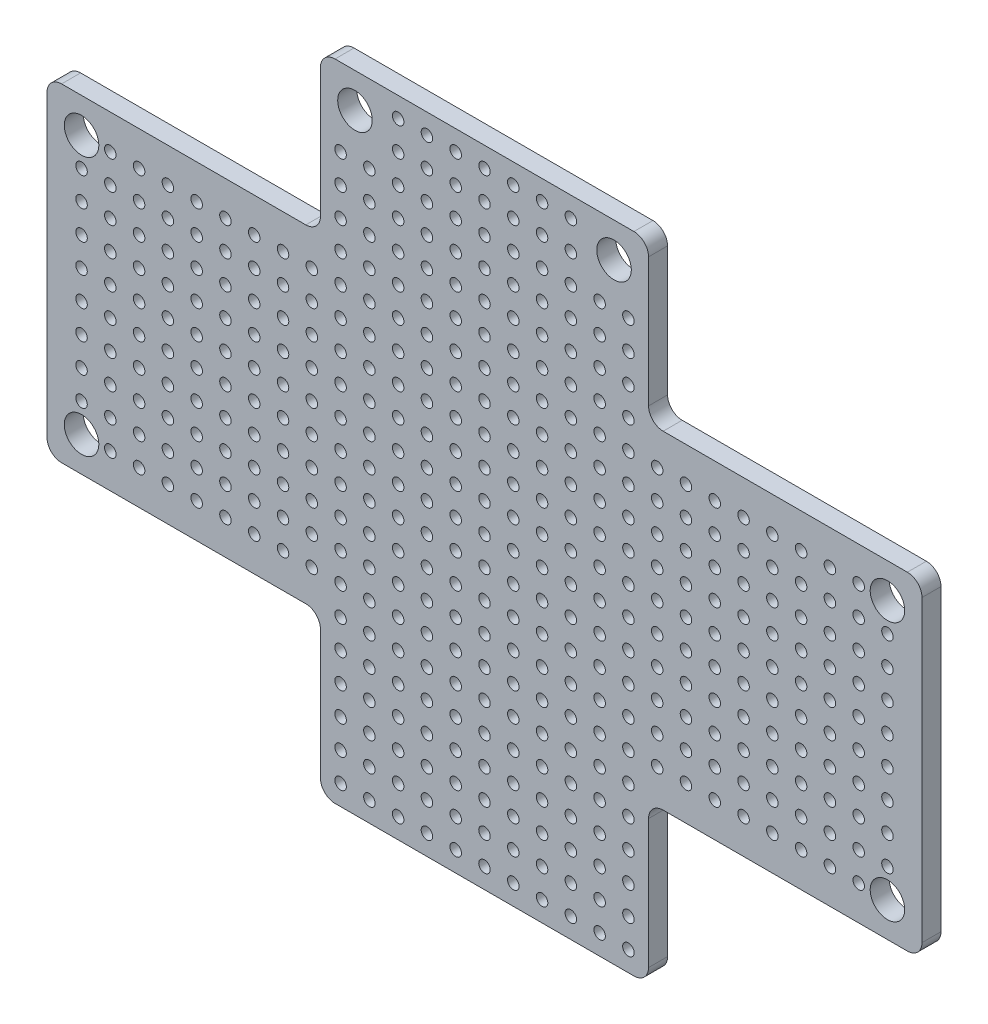
from build123d import *

# Parameters (mm, degrees)
SKETCH1_R           = 1.5
SKETCH1_R_2         = 0.5
BOSS_EXTRUDE1_DEPTH = 1.651
FILLET1_R           = 1.27


with BuildPart() as part:
    # Sketch1 → Boss-Extrude1 (new body)
    with BuildSketch(Plane.XY):
        Polygon((0, 0), (23.75, 0), (23.75, -13.75), (52.25, -13.75), (52.25, 0), (76, 0), (76, 28.5), (52.25, 28.5), (52.25, 42.25), (23.75, 42.25), (23.75, 28.5), (0, 28.5), align=None)
        with Locations((3, 25.5)):
            Circle(SKETCH1_R, mode=Mode.SUBTRACT)
        with Locations((73, 25.5)):
            Circle(SKETCH1_R, mode=Mode.SUBTRACT)
        with Locations((3, 3)):
            Circle(SKETCH1_R, mode=Mode.SUBTRACT)
        with Locations((73, 3)):
            Circle(SKETCH1_R, mode=Mode.SUBTRACT)
        with Locations((26.75, 39.25)):
            Circle(SKETCH1_R, mode=Mode.SUBTRACT)
        with Locations((5.5, 3)):
            Circle(SKETCH1_R_2, mode=Mode.SUBTRACT)
        with Locations((8, 3)):
            Circle(SKETCH1_R_2, mode=Mode.SUBTRACT)
        with Locations((10.5, 3)):
            Circle(SKETCH1_R_2, mode=Mode.SUBTRACT)
        with Locations((13, 3)):
            Circle(SKETCH1_R_2, mode=Mode.SUBTRACT)
        with Locations((15.5, 3)):
            Circle(SKETCH1_R_2, mode=Mode.SUBTRACT)
        with Locations((18, 3)):
            Circle(SKETCH1_R_2, mode=Mode.SUBTRACT)
        with Locations((20.5, 3)):
            Circle(SKETCH1_R_2, mode=Mode.SUBTRACT)
        with Locations((23, 3)):
            Circle(SKETCH1_R_2, mode=Mode.SUBTRACT)
        with Locations((25.5, 3)):
            Circle(SKETCH1_R_2, mode=Mode.SUBTRACT)
        with Locations((28, 3)):
            Circle(SKETCH1_R_2, mode=Mode.SUBTRACT)
        with Locations((30.5, 3)):
            Circle(SKETCH1_R_2, mode=Mode.SUBTRACT)
        with Locations((33, 3)):
            Circle(SKETCH1_R_2, mode=Mode.SUBTRACT)
        with Locations((35.5, 3)):
            Circle(SKETCH1_R_2, mode=Mode.SUBTRACT)
        with Locations((38, 3)):
            Circle(SKETCH1_R_2, mode=Mode.SUBTRACT)
        with Locations((40.5, 3)):
            Circle(SKETCH1_R_2, mode=Mode.SUBTRACT)
        with Locations((43, 3)):
            Circle(SKETCH1_R_2, mode=Mode.SUBTRACT)
        with Locations((45.5, 3)):
            Circle(SKETCH1_R_2, mode=Mode.SUBTRACT)
        with Locations((48, 3)):
            Circle(SKETCH1_R_2, mode=Mode.SUBTRACT)
        with Locations((50.5, 3)):
            Circle(SKETCH1_R_2, mode=Mode.SUBTRACT)
        with Locations((53, 3)):
            Circle(SKETCH1_R_2, mode=Mode.SUBTRACT)
        with Locations((55.5, 3)):
            Circle(SKETCH1_R_2, mode=Mode.SUBTRACT)
        with Locations((58, 3)):
            Circle(SKETCH1_R_2, mode=Mode.SUBTRACT)
        with Locations((60.5, 3)):
            Circle(SKETCH1_R_2, mode=Mode.SUBTRACT)
        with Locations((63, 3)):
            Circle(SKETCH1_R_2, mode=Mode.SUBTRACT)
        with Locations((65.5, 3)):
            Circle(SKETCH1_R_2, mode=Mode.SUBTRACT)
        with Locations((68, 3)):
            Circle(SKETCH1_R_2, mode=Mode.SUBTRACT)
        with Locations((70.5, 3)):
            Circle(SKETCH1_R_2, mode=Mode.SUBTRACT)
        with Locations((49.25, 39.25)):
            Circle(SKETCH1_R, mode=Mode.SUBTRACT)
        with Locations((5.5, 5.5)):
            Circle(SKETCH1_R_2, mode=Mode.SUBTRACT)
        with Locations((8, 5.5)):
            Circle(SKETCH1_R_2, mode=Mode.SUBTRACT)
        with Locations((10.5, 5.5)):
            Circle(SKETCH1_R_2, mode=Mode.SUBTRACT)
        with Locations((13, 5.5)):
            Circle(SKETCH1_R_2, mode=Mode.SUBTRACT)
        with Locations((15.5, 5.5)):
            Circle(SKETCH1_R_2, mode=Mode.SUBTRACT)
        with Locations((18, 5.5)):
            Circle(SKETCH1_R_2, mode=Mode.SUBTRACT)
        with Locations((20.5, 5.5)):
            Circle(SKETCH1_R_2, mode=Mode.SUBTRACT)
        with Locations((23, 5.5)):
            Circle(SKETCH1_R_2, mode=Mode.SUBTRACT)
        with Locations((25.5, 5.5)):
            Circle(SKETCH1_R_2, mode=Mode.SUBTRACT)
        with Locations((28, 5.5)):
            Circle(SKETCH1_R_2, mode=Mode.SUBTRACT)
        with Locations((30.5, 5.5)):
            Circle(SKETCH1_R_2, mode=Mode.SUBTRACT)
        with Locations((33, 5.5)):
            Circle(SKETCH1_R_2, mode=Mode.SUBTRACT)
        with Locations((35.5, 5.5)):
            Circle(SKETCH1_R_2, mode=Mode.SUBTRACT)
        with Locations((38, 5.5)):
            Circle(SKETCH1_R_2, mode=Mode.SUBTRACT)
        with Locations((40.5, 5.5)):
            Circle(SKETCH1_R_2, mode=Mode.SUBTRACT)
        with Locations((43, 5.5)):
            Circle(SKETCH1_R_2, mode=Mode.SUBTRACT)
        with Locations((45.5, 5.5)):
            Circle(SKETCH1_R_2, mode=Mode.SUBTRACT)
        with Locations((48, 5.5)):
            Circle(SKETCH1_R_2, mode=Mode.SUBTRACT)
        with Locations((50.5, 5.5)):
            Circle(SKETCH1_R_2, mode=Mode.SUBTRACT)
        with Locations((53, 5.5)):
            Circle(SKETCH1_R_2, mode=Mode.SUBTRACT)
        with Locations((55.5, 5.5)):
            Circle(SKETCH1_R_2, mode=Mode.SUBTRACT)
        with Locations((58, 5.5)):
            Circle(SKETCH1_R_2, mode=Mode.SUBTRACT)
        with Locations((60.5, 5.5)):
            Circle(SKETCH1_R_2, mode=Mode.SUBTRACT)
        with Locations((63, 5.5)):
            Circle(SKETCH1_R_2, mode=Mode.SUBTRACT)
        with Locations((65.5, 5.5)):
            Circle(SKETCH1_R_2, mode=Mode.SUBTRACT)
        with Locations((68, 5.5)):
            Circle(SKETCH1_R_2, mode=Mode.SUBTRACT)
        with Locations((70.5, 5.5)):
            Circle(SKETCH1_R_2, mode=Mode.SUBTRACT)
        with Locations((73, 5.5)):
            Circle(SKETCH1_R_2, mode=Mode.SUBTRACT)
        with Locations((5.5, 8)):
            Circle(SKETCH1_R_2, mode=Mode.SUBTRACT)
        with Locations((8, 8)):
            Circle(SKETCH1_R_2, mode=Mode.SUBTRACT)
        with Locations((10.5, 8)):
            Circle(SKETCH1_R_2, mode=Mode.SUBTRACT)
        with Locations((13, 8)):
            Circle(SKETCH1_R_2, mode=Mode.SUBTRACT)
        with Locations((15.5, 8)):
            Circle(SKETCH1_R_2, mode=Mode.SUBTRACT)
        with Locations((18, 8)):
            Circle(SKETCH1_R_2, mode=Mode.SUBTRACT)
        with Locations((20.5, 8)):
            Circle(SKETCH1_R_2, mode=Mode.SUBTRACT)
        with Locations((23, 8)):
            Circle(SKETCH1_R_2, mode=Mode.SUBTRACT)
        with Locations((25.5, 8)):
            Circle(SKETCH1_R_2, mode=Mode.SUBTRACT)
        with Locations((28, 8)):
            Circle(SKETCH1_R_2, mode=Mode.SUBTRACT)
        with Locations((30.5, 8)):
            Circle(SKETCH1_R_2, mode=Mode.SUBTRACT)
        with Locations((33, 8)):
            Circle(SKETCH1_R_2, mode=Mode.SUBTRACT)
        with Locations((35.5, 8)):
            Circle(SKETCH1_R_2, mode=Mode.SUBTRACT)
        with Locations((38, 8)):
            Circle(SKETCH1_R_2, mode=Mode.SUBTRACT)
        with Locations((40.5, 8)):
            Circle(SKETCH1_R_2, mode=Mode.SUBTRACT)
        with Locations((43, 8)):
            Circle(SKETCH1_R_2, mode=Mode.SUBTRACT)
        with Locations((45.5, 8)):
            Circle(SKETCH1_R_2, mode=Mode.SUBTRACT)
        with Locations((48, 8)):
            Circle(SKETCH1_R_2, mode=Mode.SUBTRACT)
        with Locations((50.5, 8)):
            Circle(SKETCH1_R_2, mode=Mode.SUBTRACT)
        with Locations((53, 8)):
            Circle(SKETCH1_R_2, mode=Mode.SUBTRACT)
        with Locations((55.5, 8)):
            Circle(SKETCH1_R_2, mode=Mode.SUBTRACT)
        with Locations((58, 8)):
            Circle(SKETCH1_R_2, mode=Mode.SUBTRACT)
        with Locations((60.5, 8)):
            Circle(SKETCH1_R_2, mode=Mode.SUBTRACT)
        with Locations((63, 8)):
            Circle(SKETCH1_R_2, mode=Mode.SUBTRACT)
        with Locations((65.5, 8)):
            Circle(SKETCH1_R_2, mode=Mode.SUBTRACT)
        with Locations((68, 8)):
            Circle(SKETCH1_R_2, mode=Mode.SUBTRACT)
        with Locations((70.5, 8)):
            Circle(SKETCH1_R_2, mode=Mode.SUBTRACT)
        with Locations((73, 8)):
            Circle(SKETCH1_R_2, mode=Mode.SUBTRACT)
        with Locations((5.5, 10.5)):
            Circle(SKETCH1_R_2, mode=Mode.SUBTRACT)
        with Locations((8, 10.5)):
            Circle(SKETCH1_R_2, mode=Mode.SUBTRACT)
        with Locations((10.5, 10.5)):
            Circle(SKETCH1_R_2, mode=Mode.SUBTRACT)
        with Locations((13, 10.5)):
            Circle(SKETCH1_R_2, mode=Mode.SUBTRACT)
        with Locations((15.5, 10.5)):
            Circle(SKETCH1_R_2, mode=Mode.SUBTRACT)
        with Locations((18, 10.5)):
            Circle(SKETCH1_R_2, mode=Mode.SUBTRACT)
        with Locations((20.5, 10.5)):
            Circle(SKETCH1_R_2, mode=Mode.SUBTRACT)
        with Locations((23, 10.5)):
            Circle(SKETCH1_R_2, mode=Mode.SUBTRACT)
        with Locations((25.5, 10.5)):
            Circle(SKETCH1_R_2, mode=Mode.SUBTRACT)
        with Locations((28, 10.5)):
            Circle(SKETCH1_R_2, mode=Mode.SUBTRACT)
        with Locations((30.5, 10.5)):
            Circle(SKETCH1_R_2, mode=Mode.SUBTRACT)
        with Locations((33, 10.5)):
            Circle(SKETCH1_R_2, mode=Mode.SUBTRACT)
        with Locations((35.5, 10.5)):
            Circle(SKETCH1_R_2, mode=Mode.SUBTRACT)
        with Locations((38, 10.5)):
            Circle(SKETCH1_R_2, mode=Mode.SUBTRACT)
        with Locations((40.5, 10.5)):
            Circle(SKETCH1_R_2, mode=Mode.SUBTRACT)
        with Locations((43, 10.5)):
            Circle(SKETCH1_R_2, mode=Mode.SUBTRACT)
        with Locations((45.5, 10.5)):
            Circle(SKETCH1_R_2, mode=Mode.SUBTRACT)
        with Locations((48, 10.5)):
            Circle(SKETCH1_R_2, mode=Mode.SUBTRACT)
        with Locations((50.5, 10.5)):
            Circle(SKETCH1_R_2, mode=Mode.SUBTRACT)
        with Locations((53, 10.5)):
            Circle(SKETCH1_R_2, mode=Mode.SUBTRACT)
        with Locations((55.5, 10.5)):
            Circle(SKETCH1_R_2, mode=Mode.SUBTRACT)
        with Locations((58, 10.5)):
            Circle(SKETCH1_R_2, mode=Mode.SUBTRACT)
        with Locations((60.5, 10.5)):
            Circle(SKETCH1_R_2, mode=Mode.SUBTRACT)
        with Locations((63, 10.5)):
            Circle(SKETCH1_R_2, mode=Mode.SUBTRACT)
        with Locations((65.5, 10.5)):
            Circle(SKETCH1_R_2, mode=Mode.SUBTRACT)
        with Locations((68, 10.5)):
            Circle(SKETCH1_R_2, mode=Mode.SUBTRACT)
        with Locations((70.5, 10.5)):
            Circle(SKETCH1_R_2, mode=Mode.SUBTRACT)
        with Locations((73, 10.5)):
            Circle(SKETCH1_R_2, mode=Mode.SUBTRACT)
        with Locations((5.5, 13)):
            Circle(SKETCH1_R_2, mode=Mode.SUBTRACT)
        with Locations((8, 13)):
            Circle(SKETCH1_R_2, mode=Mode.SUBTRACT)
        with Locations((10.5, 13)):
            Circle(SKETCH1_R_2, mode=Mode.SUBTRACT)
        with Locations((13, 13)):
            Circle(SKETCH1_R_2, mode=Mode.SUBTRACT)
        with Locations((15.5, 13)):
            Circle(SKETCH1_R_2, mode=Mode.SUBTRACT)
        with Locations((18, 13)):
            Circle(SKETCH1_R_2, mode=Mode.SUBTRACT)
        with Locations((20.5, 13)):
            Circle(SKETCH1_R_2, mode=Mode.SUBTRACT)
        with Locations((23, 13)):
            Circle(SKETCH1_R_2, mode=Mode.SUBTRACT)
        with Locations((25.5, 13)):
            Circle(SKETCH1_R_2, mode=Mode.SUBTRACT)
        with Locations((28, 13)):
            Circle(SKETCH1_R_2, mode=Mode.SUBTRACT)
        with Locations((30.5, 13)):
            Circle(SKETCH1_R_2, mode=Mode.SUBTRACT)
        with Locations((33, 13)):
            Circle(SKETCH1_R_2, mode=Mode.SUBTRACT)
        with Locations((35.5, 13)):
            Circle(SKETCH1_R_2, mode=Mode.SUBTRACT)
        with Locations((38, 13)):
            Circle(SKETCH1_R_2, mode=Mode.SUBTRACT)
        with Locations((40.5, 13)):
            Circle(SKETCH1_R_2, mode=Mode.SUBTRACT)
        with Locations((43, 13)):
            Circle(SKETCH1_R_2, mode=Mode.SUBTRACT)
        with Locations((45.5, 13)):
            Circle(SKETCH1_R_2, mode=Mode.SUBTRACT)
        with Locations((48, 13)):
            Circle(SKETCH1_R_2, mode=Mode.SUBTRACT)
        with Locations((50.5, 13)):
            Circle(SKETCH1_R_2, mode=Mode.SUBTRACT)
        with Locations((53, 13)):
            Circle(SKETCH1_R_2, mode=Mode.SUBTRACT)
        with Locations((55.5, 13)):
            Circle(SKETCH1_R_2, mode=Mode.SUBTRACT)
        with Locations((58, 13)):
            Circle(SKETCH1_R_2, mode=Mode.SUBTRACT)
        with Locations((60.5, 13)):
            Circle(SKETCH1_R_2, mode=Mode.SUBTRACT)
        with Locations((63, 13)):
            Circle(SKETCH1_R_2, mode=Mode.SUBTRACT)
        with Locations((65.5, 13)):
            Circle(SKETCH1_R_2, mode=Mode.SUBTRACT)
        with Locations((68, 13)):
            Circle(SKETCH1_R_2, mode=Mode.SUBTRACT)
        with Locations((70.5, 13)):
            Circle(SKETCH1_R_2, mode=Mode.SUBTRACT)
        with Locations((73, 13)):
            Circle(SKETCH1_R_2, mode=Mode.SUBTRACT)
        with Locations((5.5, 15.5)):
            Circle(SKETCH1_R_2, mode=Mode.SUBTRACT)
        with Locations((8, 15.5)):
            Circle(SKETCH1_R_2, mode=Mode.SUBTRACT)
        with Locations((10.5, 15.5)):
            Circle(SKETCH1_R_2, mode=Mode.SUBTRACT)
        with Locations((13, 15.5)):
            Circle(SKETCH1_R_2, mode=Mode.SUBTRACT)
        with Locations((15.5, 15.5)):
            Circle(SKETCH1_R_2, mode=Mode.SUBTRACT)
        with Locations((18, 15.5)):
            Circle(SKETCH1_R_2, mode=Mode.SUBTRACT)
        with Locations((20.5, 15.5)):
            Circle(SKETCH1_R_2, mode=Mode.SUBTRACT)
        with Locations((23, 15.5)):
            Circle(SKETCH1_R_2, mode=Mode.SUBTRACT)
        with Locations((25.5, 15.5)):
            Circle(SKETCH1_R_2, mode=Mode.SUBTRACT)
        with Locations((28, 15.5)):
            Circle(SKETCH1_R_2, mode=Mode.SUBTRACT)
        with Locations((30.5, 15.5)):
            Circle(SKETCH1_R_2, mode=Mode.SUBTRACT)
        with Locations((33, 15.5)):
            Circle(SKETCH1_R_2, mode=Mode.SUBTRACT)
        with Locations((35.5, 15.5)):
            Circle(SKETCH1_R_2, mode=Mode.SUBTRACT)
        with Locations((38, 15.5)):
            Circle(SKETCH1_R_2, mode=Mode.SUBTRACT)
        with Locations((40.5, 15.5)):
            Circle(SKETCH1_R_2, mode=Mode.SUBTRACT)
        with Locations((43, 15.5)):
            Circle(SKETCH1_R_2, mode=Mode.SUBTRACT)
        with Locations((45.5, 15.5)):
            Circle(SKETCH1_R_2, mode=Mode.SUBTRACT)
        with Locations((48, 15.5)):
            Circle(SKETCH1_R_2, mode=Mode.SUBTRACT)
        with Locations((50.5, 15.5)):
            Circle(SKETCH1_R_2, mode=Mode.SUBTRACT)
        with Locations((53, 15.5)):
            Circle(SKETCH1_R_2, mode=Mode.SUBTRACT)
        with Locations((55.5, 15.5)):
            Circle(SKETCH1_R_2, mode=Mode.SUBTRACT)
        with Locations((58, 15.5)):
            Circle(SKETCH1_R_2, mode=Mode.SUBTRACT)
        with Locations((60.5, 15.5)):
            Circle(SKETCH1_R_2, mode=Mode.SUBTRACT)
        with Locations((63, 15.5)):
            Circle(SKETCH1_R_2, mode=Mode.SUBTRACT)
        with Locations((65.5, 15.5)):
            Circle(SKETCH1_R_2, mode=Mode.SUBTRACT)
        with Locations((68, 15.5)):
            Circle(SKETCH1_R_2, mode=Mode.SUBTRACT)
        with Locations((70.5, 15.5)):
            Circle(SKETCH1_R_2, mode=Mode.SUBTRACT)
        with Locations((73, 15.5)):
            Circle(SKETCH1_R_2, mode=Mode.SUBTRACT)
        with Locations((5.5, 18)):
            Circle(SKETCH1_R_2, mode=Mode.SUBTRACT)
        with Locations((8, 18)):
            Circle(SKETCH1_R_2, mode=Mode.SUBTRACT)
        with Locations((10.5, 18)):
            Circle(SKETCH1_R_2, mode=Mode.SUBTRACT)
        with Locations((13, 18)):
            Circle(SKETCH1_R_2, mode=Mode.SUBTRACT)
        with Locations((15.5, 18)):
            Circle(SKETCH1_R_2, mode=Mode.SUBTRACT)
        with Locations((18, 18)):
            Circle(SKETCH1_R_2, mode=Mode.SUBTRACT)
        with Locations((20.5, 18)):
            Circle(SKETCH1_R_2, mode=Mode.SUBTRACT)
        with Locations((23, 18)):
            Circle(SKETCH1_R_2, mode=Mode.SUBTRACT)
        with Locations((25.5, 18)):
            Circle(SKETCH1_R_2, mode=Mode.SUBTRACT)
        with Locations((28, 18)):
            Circle(SKETCH1_R_2, mode=Mode.SUBTRACT)
        with Locations((30.5, 18)):
            Circle(SKETCH1_R_2, mode=Mode.SUBTRACT)
        with Locations((33, 18)):
            Circle(SKETCH1_R_2, mode=Mode.SUBTRACT)
        with Locations((35.5, 18)):
            Circle(SKETCH1_R_2, mode=Mode.SUBTRACT)
        with Locations((38, 18)):
            Circle(SKETCH1_R_2, mode=Mode.SUBTRACT)
        with Locations((40.5, 18)):
            Circle(SKETCH1_R_2, mode=Mode.SUBTRACT)
        with Locations((43, 18)):
            Circle(SKETCH1_R_2, mode=Mode.SUBTRACT)
        with Locations((45.5, 18)):
            Circle(SKETCH1_R_2, mode=Mode.SUBTRACT)
        with Locations((48, 18)):
            Circle(SKETCH1_R_2, mode=Mode.SUBTRACT)
        with Locations((50.5, 18)):
            Circle(SKETCH1_R_2, mode=Mode.SUBTRACT)
        with Locations((53, 18)):
            Circle(SKETCH1_R_2, mode=Mode.SUBTRACT)
        with Locations((55.5, 18)):
            Circle(SKETCH1_R_2, mode=Mode.SUBTRACT)
        with Locations((58, 18)):
            Circle(SKETCH1_R_2, mode=Mode.SUBTRACT)
        with Locations((60.5, 18)):
            Circle(SKETCH1_R_2, mode=Mode.SUBTRACT)
        with Locations((63, 18)):
            Circle(SKETCH1_R_2, mode=Mode.SUBTRACT)
        with Locations((65.5, 18)):
            Circle(SKETCH1_R_2, mode=Mode.SUBTRACT)
        with Locations((68, 18)):
            Circle(SKETCH1_R_2, mode=Mode.SUBTRACT)
        with Locations((70.5, 18)):
            Circle(SKETCH1_R_2, mode=Mode.SUBTRACT)
        with Locations((73, 18)):
            Circle(SKETCH1_R_2, mode=Mode.SUBTRACT)
        with Locations((5.5, 20.5)):
            Circle(SKETCH1_R_2, mode=Mode.SUBTRACT)
        with Locations((8, 20.5)):
            Circle(SKETCH1_R_2, mode=Mode.SUBTRACT)
        with Locations((10.5, 20.5)):
            Circle(SKETCH1_R_2, mode=Mode.SUBTRACT)
        with Locations((13, 20.5)):
            Circle(SKETCH1_R_2, mode=Mode.SUBTRACT)
        with Locations((15.5, 20.5)):
            Circle(SKETCH1_R_2, mode=Mode.SUBTRACT)
        with Locations((18, 20.5)):
            Circle(SKETCH1_R_2, mode=Mode.SUBTRACT)
        with Locations((20.5, 20.5)):
            Circle(SKETCH1_R_2, mode=Mode.SUBTRACT)
        with Locations((23, 20.5)):
            Circle(SKETCH1_R_2, mode=Mode.SUBTRACT)
        with Locations((25.5, 20.5)):
            Circle(SKETCH1_R_2, mode=Mode.SUBTRACT)
        with Locations((28, 20.5)):
            Circle(SKETCH1_R_2, mode=Mode.SUBTRACT)
        with Locations((30.5, 20.5)):
            Circle(SKETCH1_R_2, mode=Mode.SUBTRACT)
        with Locations((33, 20.5)):
            Circle(SKETCH1_R_2, mode=Mode.SUBTRACT)
        with Locations((35.5, 20.5)):
            Circle(SKETCH1_R_2, mode=Mode.SUBTRACT)
        with Locations((38, 20.5)):
            Circle(SKETCH1_R_2, mode=Mode.SUBTRACT)
        with Locations((40.5, 20.5)):
            Circle(SKETCH1_R_2, mode=Mode.SUBTRACT)
        with Locations((43, 20.5)):
            Circle(SKETCH1_R_2, mode=Mode.SUBTRACT)
        with Locations((45.5, 20.5)):
            Circle(SKETCH1_R_2, mode=Mode.SUBTRACT)
        with Locations((48, 20.5)):
            Circle(SKETCH1_R_2, mode=Mode.SUBTRACT)
        with Locations((50.5, 20.5)):
            Circle(SKETCH1_R_2, mode=Mode.SUBTRACT)
        with Locations((53, 20.5)):
            Circle(SKETCH1_R_2, mode=Mode.SUBTRACT)
        with Locations((55.5, 20.5)):
            Circle(SKETCH1_R_2, mode=Mode.SUBTRACT)
        with Locations((58, 20.5)):
            Circle(SKETCH1_R_2, mode=Mode.SUBTRACT)
        with Locations((60.5, 20.5)):
            Circle(SKETCH1_R_2, mode=Mode.SUBTRACT)
        with Locations((63, 20.5)):
            Circle(SKETCH1_R_2, mode=Mode.SUBTRACT)
        with Locations((65.5, 20.5)):
            Circle(SKETCH1_R_2, mode=Mode.SUBTRACT)
        with Locations((68, 20.5)):
            Circle(SKETCH1_R_2, mode=Mode.SUBTRACT)
        with Locations((70.5, 20.5)):
            Circle(SKETCH1_R_2, mode=Mode.SUBTRACT)
        with Locations((73, 20.5)):
            Circle(SKETCH1_R_2, mode=Mode.SUBTRACT)
        with Locations((5.5, 23)):
            Circle(SKETCH1_R_2, mode=Mode.SUBTRACT)
        with Locations((8, 23)):
            Circle(SKETCH1_R_2, mode=Mode.SUBTRACT)
        with Locations((10.5, 23)):
            Circle(SKETCH1_R_2, mode=Mode.SUBTRACT)
        with Locations((13, 23)):
            Circle(SKETCH1_R_2, mode=Mode.SUBTRACT)
        with Locations((15.5, 23)):
            Circle(SKETCH1_R_2, mode=Mode.SUBTRACT)
        with Locations((18, 23)):
            Circle(SKETCH1_R_2, mode=Mode.SUBTRACT)
        with Locations((20.5, 23)):
            Circle(SKETCH1_R_2, mode=Mode.SUBTRACT)
        with Locations((23, 23)):
            Circle(SKETCH1_R_2, mode=Mode.SUBTRACT)
        with Locations((25.5, 23)):
            Circle(SKETCH1_R_2, mode=Mode.SUBTRACT)
        with Locations((28, 23)):
            Circle(SKETCH1_R_2, mode=Mode.SUBTRACT)
        with Locations((30.5, 23)):
            Circle(SKETCH1_R_2, mode=Mode.SUBTRACT)
        with Locations((33, 23)):
            Circle(SKETCH1_R_2, mode=Mode.SUBTRACT)
        with Locations((35.5, 23)):
            Circle(SKETCH1_R_2, mode=Mode.SUBTRACT)
        with Locations((38, 23)):
            Circle(SKETCH1_R_2, mode=Mode.SUBTRACT)
        with Locations((40.5, 23)):
            Circle(SKETCH1_R_2, mode=Mode.SUBTRACT)
        with Locations((43, 23)):
            Circle(SKETCH1_R_2, mode=Mode.SUBTRACT)
        with Locations((45.5, 23)):
            Circle(SKETCH1_R_2, mode=Mode.SUBTRACT)
        with Locations((48, 23)):
            Circle(SKETCH1_R_2, mode=Mode.SUBTRACT)
        with Locations((50.5, 23)):
            Circle(SKETCH1_R_2, mode=Mode.SUBTRACT)
        with Locations((53, 23)):
            Circle(SKETCH1_R_2, mode=Mode.SUBTRACT)
        with Locations((55.5, 23)):
            Circle(SKETCH1_R_2, mode=Mode.SUBTRACT)
        with Locations((58, 23)):
            Circle(SKETCH1_R_2, mode=Mode.SUBTRACT)
        with Locations((60.5, 23)):
            Circle(SKETCH1_R_2, mode=Mode.SUBTRACT)
        with Locations((63, 23)):
            Circle(SKETCH1_R_2, mode=Mode.SUBTRACT)
        with Locations((65.5, 23)):
            Circle(SKETCH1_R_2, mode=Mode.SUBTRACT)
        with Locations((68, 23)):
            Circle(SKETCH1_R_2, mode=Mode.SUBTRACT)
        with Locations((70.5, 23)):
            Circle(SKETCH1_R_2, mode=Mode.SUBTRACT)
        with Locations((73, 23)):
            Circle(SKETCH1_R_2, mode=Mode.SUBTRACT)
        with Locations((5.5, 25.5)):
            Circle(SKETCH1_R_2, mode=Mode.SUBTRACT)
        with Locations((8, 25.5)):
            Circle(SKETCH1_R_2, mode=Mode.SUBTRACT)
        with Locations((10.5, 25.5)):
            Circle(SKETCH1_R_2, mode=Mode.SUBTRACT)
        with Locations((13, 25.5)):
            Circle(SKETCH1_R_2, mode=Mode.SUBTRACT)
        with Locations((15.5, 25.5)):
            Circle(SKETCH1_R_2, mode=Mode.SUBTRACT)
        with Locations((18, 25.5)):
            Circle(SKETCH1_R_2, mode=Mode.SUBTRACT)
        with Locations((20.5, 25.5)):
            Circle(SKETCH1_R_2, mode=Mode.SUBTRACT)
        with Locations((23, 25.5)):
            Circle(SKETCH1_R_2, mode=Mode.SUBTRACT)
        with Locations((25.5, 25.5)):
            Circle(SKETCH1_R_2, mode=Mode.SUBTRACT)
        with Locations((28, 25.5)):
            Circle(SKETCH1_R_2, mode=Mode.SUBTRACT)
        with Locations((30.5, 25.5)):
            Circle(SKETCH1_R_2, mode=Mode.SUBTRACT)
        with Locations((33, 25.5)):
            Circle(SKETCH1_R_2, mode=Mode.SUBTRACT)
        with Locations((35.5, 25.5)):
            Circle(SKETCH1_R_2, mode=Mode.SUBTRACT)
        with Locations((38, 25.5)):
            Circle(SKETCH1_R_2, mode=Mode.SUBTRACT)
        with Locations((40.5, 25.5)):
            Circle(SKETCH1_R_2, mode=Mode.SUBTRACT)
        with Locations((43, 25.5)):
            Circle(SKETCH1_R_2, mode=Mode.SUBTRACT)
        with Locations((45.5, 25.5)):
            Circle(SKETCH1_R_2, mode=Mode.SUBTRACT)
        with Locations((48, 25.5)):
            Circle(SKETCH1_R_2, mode=Mode.SUBTRACT)
        with Locations((50.5, 25.5)):
            Circle(SKETCH1_R_2, mode=Mode.SUBTRACT)
        with Locations((53, 25.5)):
            Circle(SKETCH1_R_2, mode=Mode.SUBTRACT)
        with Locations((55.5, 25.5)):
            Circle(SKETCH1_R_2, mode=Mode.SUBTRACT)
        with Locations((58, 25.5)):
            Circle(SKETCH1_R_2, mode=Mode.SUBTRACT)
        with Locations((60.5, 25.5)):
            Circle(SKETCH1_R_2, mode=Mode.SUBTRACT)
        with Locations((63, 25.5)):
            Circle(SKETCH1_R_2, mode=Mode.SUBTRACT)
        with Locations((65.5, 25.5)):
            Circle(SKETCH1_R_2, mode=Mode.SUBTRACT)
        with Locations((68, 25.5)):
            Circle(SKETCH1_R_2, mode=Mode.SUBTRACT)
        with Locations((70.5, 25.5)):
            Circle(SKETCH1_R_2, mode=Mode.SUBTRACT)
        with Locations((3, 5.5)):
            Circle(SKETCH1_R_2, mode=Mode.SUBTRACT)
        with Locations((3, 8)):
            Circle(SKETCH1_R_2, mode=Mode.SUBTRACT)
        with Locations((3, 10.5)):
            Circle(SKETCH1_R_2, mode=Mode.SUBTRACT)
        with Locations((3, 13)):
            Circle(SKETCH1_R_2, mode=Mode.SUBTRACT)
        with Locations((3, 15.5)):
            Circle(SKETCH1_R_2, mode=Mode.SUBTRACT)
        with Locations((3, 18)):
            Circle(SKETCH1_R_2, mode=Mode.SUBTRACT)
        with Locations((3, 20.5)):
            Circle(SKETCH1_R_2, mode=Mode.SUBTRACT)
        with Locations((3, 23)):
            Circle(SKETCH1_R_2, mode=Mode.SUBTRACT)
        with Locations((25.5, 28)):
            Circle(SKETCH1_R_2, mode=Mode.SUBTRACT)
        with Locations((28, 28)):
            Circle(SKETCH1_R_2, mode=Mode.SUBTRACT)
        with Locations((30.5, 28)):
            Circle(SKETCH1_R_2, mode=Mode.SUBTRACT)
        with Locations((33, 28)):
            Circle(SKETCH1_R_2, mode=Mode.SUBTRACT)
        with Locations((35.5, 28)):
            Circle(SKETCH1_R_2, mode=Mode.SUBTRACT)
        with Locations((38, 28)):
            Circle(SKETCH1_R_2, mode=Mode.SUBTRACT)
        with Locations((40.5, 28)):
            Circle(SKETCH1_R_2, mode=Mode.SUBTRACT)
        with Locations((43, 28)):
            Circle(SKETCH1_R_2, mode=Mode.SUBTRACT)
        with Locations((45.5, 28)):
            Circle(SKETCH1_R_2, mode=Mode.SUBTRACT)
        with Locations((48, 28)):
            Circle(SKETCH1_R_2, mode=Mode.SUBTRACT)
        with Locations((50.5, 28)):
            Circle(SKETCH1_R_2, mode=Mode.SUBTRACT)
        with Locations((25.5, 30.5)):
            Circle(SKETCH1_R_2, mode=Mode.SUBTRACT)
        with Locations((28, 30.5)):
            Circle(SKETCH1_R_2, mode=Mode.SUBTRACT)
        with Locations((30.5, 30.5)):
            Circle(SKETCH1_R_2, mode=Mode.SUBTRACT)
        with Locations((33, 30.5)):
            Circle(SKETCH1_R_2, mode=Mode.SUBTRACT)
        with Locations((35.5, 30.5)):
            Circle(SKETCH1_R_2, mode=Mode.SUBTRACT)
        with Locations((38, 30.5)):
            Circle(SKETCH1_R_2, mode=Mode.SUBTRACT)
        with Locations((40.5, 30.5)):
            Circle(SKETCH1_R_2, mode=Mode.SUBTRACT)
        with Locations((43, 30.5)):
            Circle(SKETCH1_R_2, mode=Mode.SUBTRACT)
        with Locations((45.5, 30.5)):
            Circle(SKETCH1_R_2, mode=Mode.SUBTRACT)
        with Locations((48, 30.5)):
            Circle(SKETCH1_R_2, mode=Mode.SUBTRACT)
        with Locations((50.5, 30.5)):
            Circle(SKETCH1_R_2, mode=Mode.SUBTRACT)
        with Locations((25.5, 33)):
            Circle(SKETCH1_R_2, mode=Mode.SUBTRACT)
        with Locations((28, 33)):
            Circle(SKETCH1_R_2, mode=Mode.SUBTRACT)
        with Locations((30.5, 33)):
            Circle(SKETCH1_R_2, mode=Mode.SUBTRACT)
        with Locations((33, 33)):
            Circle(SKETCH1_R_2, mode=Mode.SUBTRACT)
        with Locations((35.5, 33)):
            Circle(SKETCH1_R_2, mode=Mode.SUBTRACT)
        with Locations((38, 33)):
            Circle(SKETCH1_R_2, mode=Mode.SUBTRACT)
        with Locations((40.5, 33)):
            Circle(SKETCH1_R_2, mode=Mode.SUBTRACT)
        with Locations((43, 33)):
            Circle(SKETCH1_R_2, mode=Mode.SUBTRACT)
        with Locations((45.5, 33)):
            Circle(SKETCH1_R_2, mode=Mode.SUBTRACT)
        with Locations((48, 33)):
            Circle(SKETCH1_R_2, mode=Mode.SUBTRACT)
        with Locations((50.5, 33)):
            Circle(SKETCH1_R_2, mode=Mode.SUBTRACT)
        with Locations((25.5, 35.5)):
            Circle(SKETCH1_R_2, mode=Mode.SUBTRACT)
        with Locations((28, 35.5)):
            Circle(SKETCH1_R_2, mode=Mode.SUBTRACT)
        with Locations((30.5, 35.5)):
            Circle(SKETCH1_R_2, mode=Mode.SUBTRACT)
        with Locations((33, 35.5)):
            Circle(SKETCH1_R_2, mode=Mode.SUBTRACT)
        with Locations((35.5, 35.5)):
            Circle(SKETCH1_R_2, mode=Mode.SUBTRACT)
        with Locations((38, 35.5)):
            Circle(SKETCH1_R_2, mode=Mode.SUBTRACT)
        with Locations((40.5, 35.5)):
            Circle(SKETCH1_R_2, mode=Mode.SUBTRACT)
        with Locations((43, 35.5)):
            Circle(SKETCH1_R_2, mode=Mode.SUBTRACT)
        with Locations((45.5, 35.5)):
            Circle(SKETCH1_R_2, mode=Mode.SUBTRACT)
        with Locations((48, 35.5)):
            Circle(SKETCH1_R_2, mode=Mode.SUBTRACT)
        with Locations((50.5, 35.5)):
            Circle(SKETCH1_R_2, mode=Mode.SUBTRACT)
        with Locations((30.5, 38)):
            Circle(SKETCH1_R_2, mode=Mode.SUBTRACT)
        with Locations((33, 38)):
            Circle(SKETCH1_R_2, mode=Mode.SUBTRACT)
        with Locations((35.5, 38)):
            Circle(SKETCH1_R_2, mode=Mode.SUBTRACT)
        with Locations((38, 38)):
            Circle(SKETCH1_R_2, mode=Mode.SUBTRACT)
        with Locations((40.5, 38)):
            Circle(SKETCH1_R_2, mode=Mode.SUBTRACT)
        with Locations((43, 38)):
            Circle(SKETCH1_R_2, mode=Mode.SUBTRACT)
        with Locations((45.5, 38)):
            Circle(SKETCH1_R_2, mode=Mode.SUBTRACT)
        with Locations((30.5, 40.5)):
            Circle(SKETCH1_R_2, mode=Mode.SUBTRACT)
        with Locations((33, 40.5)):
            Circle(SKETCH1_R_2, mode=Mode.SUBTRACT)
        with Locations((35.5, 40.5)):
            Circle(SKETCH1_R_2, mode=Mode.SUBTRACT)
        with Locations((38, 40.5)):
            Circle(SKETCH1_R_2, mode=Mode.SUBTRACT)
        with Locations((40.5, 40.5)):
            Circle(SKETCH1_R_2, mode=Mode.SUBTRACT)
        with Locations((43, 40.5)):
            Circle(SKETCH1_R_2, mode=Mode.SUBTRACT)
        with Locations((45.5, 40.5)):
            Circle(SKETCH1_R_2, mode=Mode.SUBTRACT)
        with Locations((25.5, -12)):
            Circle(SKETCH1_R_2, mode=Mode.SUBTRACT)
        with Locations((25.5, -9.5)):
            Circle(SKETCH1_R_2, mode=Mode.SUBTRACT)
        with Locations((25.5, -7)):
            Circle(SKETCH1_R_2, mode=Mode.SUBTRACT)
        with Locations((25.5, -4.5)):
            Circle(SKETCH1_R_2, mode=Mode.SUBTRACT)
        with Locations((25.5, -2)):
            Circle(SKETCH1_R_2, mode=Mode.SUBTRACT)
        with Locations((25.5, 0.5)):
            Circle(SKETCH1_R_2, mode=Mode.SUBTRACT)
        with Locations((50.5, -12)):
            Circle(SKETCH1_R_2, mode=Mode.SUBTRACT)
        with Locations((48, -12)):
            Circle(SKETCH1_R_2, mode=Mode.SUBTRACT)
        with Locations((45.5, -12)):
            Circle(SKETCH1_R_2, mode=Mode.SUBTRACT)
        with Locations((43, -12)):
            Circle(SKETCH1_R_2, mode=Mode.SUBTRACT)
        with Locations((40.5, -12)):
            Circle(SKETCH1_R_2, mode=Mode.SUBTRACT)
        with Locations((38, -12)):
            Circle(SKETCH1_R_2, mode=Mode.SUBTRACT)
        with Locations((35.5, -12)):
            Circle(SKETCH1_R_2, mode=Mode.SUBTRACT)
        with Locations((33, -12)):
            Circle(SKETCH1_R_2, mode=Mode.SUBTRACT)
        with Locations((30.5, -12)):
            Circle(SKETCH1_R_2, mode=Mode.SUBTRACT)
        with Locations((28, -12)):
            Circle(SKETCH1_R_2, mode=Mode.SUBTRACT)
        with Locations((50.5, -9.5)):
            Circle(SKETCH1_R_2, mode=Mode.SUBTRACT)
        with Locations((48, -9.5)):
            Circle(SKETCH1_R_2, mode=Mode.SUBTRACT)
        with Locations((45.5, -9.5)):
            Circle(SKETCH1_R_2, mode=Mode.SUBTRACT)
        with Locations((43, -9.5)):
            Circle(SKETCH1_R_2, mode=Mode.SUBTRACT)
        with Locations((40.5, -9.5)):
            Circle(SKETCH1_R_2, mode=Mode.SUBTRACT)
        with Locations((38, -9.5)):
            Circle(SKETCH1_R_2, mode=Mode.SUBTRACT)
        with Locations((35.5, -9.5)):
            Circle(SKETCH1_R_2, mode=Mode.SUBTRACT)
        with Locations((33, -9.5)):
            Circle(SKETCH1_R_2, mode=Mode.SUBTRACT)
        with Locations((30.5, -9.5)):
            Circle(SKETCH1_R_2, mode=Mode.SUBTRACT)
        with Locations((28, -9.5)):
            Circle(SKETCH1_R_2, mode=Mode.SUBTRACT)
        with Locations((50.5, -7)):
            Circle(SKETCH1_R_2, mode=Mode.SUBTRACT)
        with Locations((48, -7)):
            Circle(SKETCH1_R_2, mode=Mode.SUBTRACT)
        with Locations((45.5, -7)):
            Circle(SKETCH1_R_2, mode=Mode.SUBTRACT)
        with Locations((43, -7)):
            Circle(SKETCH1_R_2, mode=Mode.SUBTRACT)
        with Locations((40.5, -7)):
            Circle(SKETCH1_R_2, mode=Mode.SUBTRACT)
        with Locations((38, -7)):
            Circle(SKETCH1_R_2, mode=Mode.SUBTRACT)
        with Locations((35.5, -7)):
            Circle(SKETCH1_R_2, mode=Mode.SUBTRACT)
        with Locations((33, -7)):
            Circle(SKETCH1_R_2, mode=Mode.SUBTRACT)
        with Locations((30.5, -7)):
            Circle(SKETCH1_R_2, mode=Mode.SUBTRACT)
        with Locations((28, -7)):
            Circle(SKETCH1_R_2, mode=Mode.SUBTRACT)
        with Locations((50.5, -4.5)):
            Circle(SKETCH1_R_2, mode=Mode.SUBTRACT)
        with Locations((48, -4.5)):
            Circle(SKETCH1_R_2, mode=Mode.SUBTRACT)
        with Locations((45.5, -4.5)):
            Circle(SKETCH1_R_2, mode=Mode.SUBTRACT)
        with Locations((43, -4.5)):
            Circle(SKETCH1_R_2, mode=Mode.SUBTRACT)
        with Locations((40.5, -4.5)):
            Circle(SKETCH1_R_2, mode=Mode.SUBTRACT)
        with Locations((38, -4.5)):
            Circle(SKETCH1_R_2, mode=Mode.SUBTRACT)
        with Locations((35.5, -4.5)):
            Circle(SKETCH1_R_2, mode=Mode.SUBTRACT)
        with Locations((33, -4.5)):
            Circle(SKETCH1_R_2, mode=Mode.SUBTRACT)
        with Locations((30.5, -4.5)):
            Circle(SKETCH1_R_2, mode=Mode.SUBTRACT)
        with Locations((28, -4.5)):
            Circle(SKETCH1_R_2, mode=Mode.SUBTRACT)
        with Locations((50.5, -2)):
            Circle(SKETCH1_R_2, mode=Mode.SUBTRACT)
        with Locations((48, -2)):
            Circle(SKETCH1_R_2, mode=Mode.SUBTRACT)
        with Locations((45.5, -2)):
            Circle(SKETCH1_R_2, mode=Mode.SUBTRACT)
        with Locations((43, -2)):
            Circle(SKETCH1_R_2, mode=Mode.SUBTRACT)
        with Locations((40.5, -2)):
            Circle(SKETCH1_R_2, mode=Mode.SUBTRACT)
        with Locations((38, -2)):
            Circle(SKETCH1_R_2, mode=Mode.SUBTRACT)
        with Locations((35.5, -2)):
            Circle(SKETCH1_R_2, mode=Mode.SUBTRACT)
        with Locations((33, -2)):
            Circle(SKETCH1_R_2, mode=Mode.SUBTRACT)
        with Locations((30.5, -2)):
            Circle(SKETCH1_R_2, mode=Mode.SUBTRACT)
        with Locations((28, -2)):
            Circle(SKETCH1_R_2, mode=Mode.SUBTRACT)
        with Locations((50.5, 0.5)):
            Circle(SKETCH1_R_2, mode=Mode.SUBTRACT)
        with Locations((48, 0.5)):
            Circle(SKETCH1_R_2, mode=Mode.SUBTRACT)
        with Locations((45.5, 0.5)):
            Circle(SKETCH1_R_2, mode=Mode.SUBTRACT)
        with Locations((43, 0.5)):
            Circle(SKETCH1_R_2, mode=Mode.SUBTRACT)
        with Locations((40.5, 0.5)):
            Circle(SKETCH1_R_2, mode=Mode.SUBTRACT)
        with Locations((38, 0.5)):
            Circle(SKETCH1_R_2, mode=Mode.SUBTRACT)
        with Locations((35.5, 0.5)):
            Circle(SKETCH1_R_2, mode=Mode.SUBTRACT)
        with Locations((33, 0.5)):
            Circle(SKETCH1_R_2, mode=Mode.SUBTRACT)
        with Locations((30.5, 0.5)):
            Circle(SKETCH1_R_2, mode=Mode.SUBTRACT)
        with Locations((28, 0.5)):
            Circle(SKETCH1_R_2, mode=Mode.SUBTRACT)
    extrude(amount=BOSS_EXTRUDE1_DEPTH)

    # Fillet1
    fillet1_edges = [part.edges().sort_by_distance(p)[0] for p in [
        (0, 28.5, 0.8255),
        (0, 0, 0.8255),
        (52.25, 42.25, 0.8255),
        (23.75, 42.25, 0.8255),
        (23.75, 28.5, 0.8255),
        (23.75, 0, 0.8255),
        (23.75, -13.75, 0.8255),
        (52.25, -13.75, 0.8255),
        (52.25, 28.5, 0.8255),
        (52.25, 0, 0.8255),
        (76, 0, 0.8255),
        (76, 28.5, 0.8255),
    ]]
    fillet(fillet1_edges, radius=FILLET1_R)


solid = part.part
